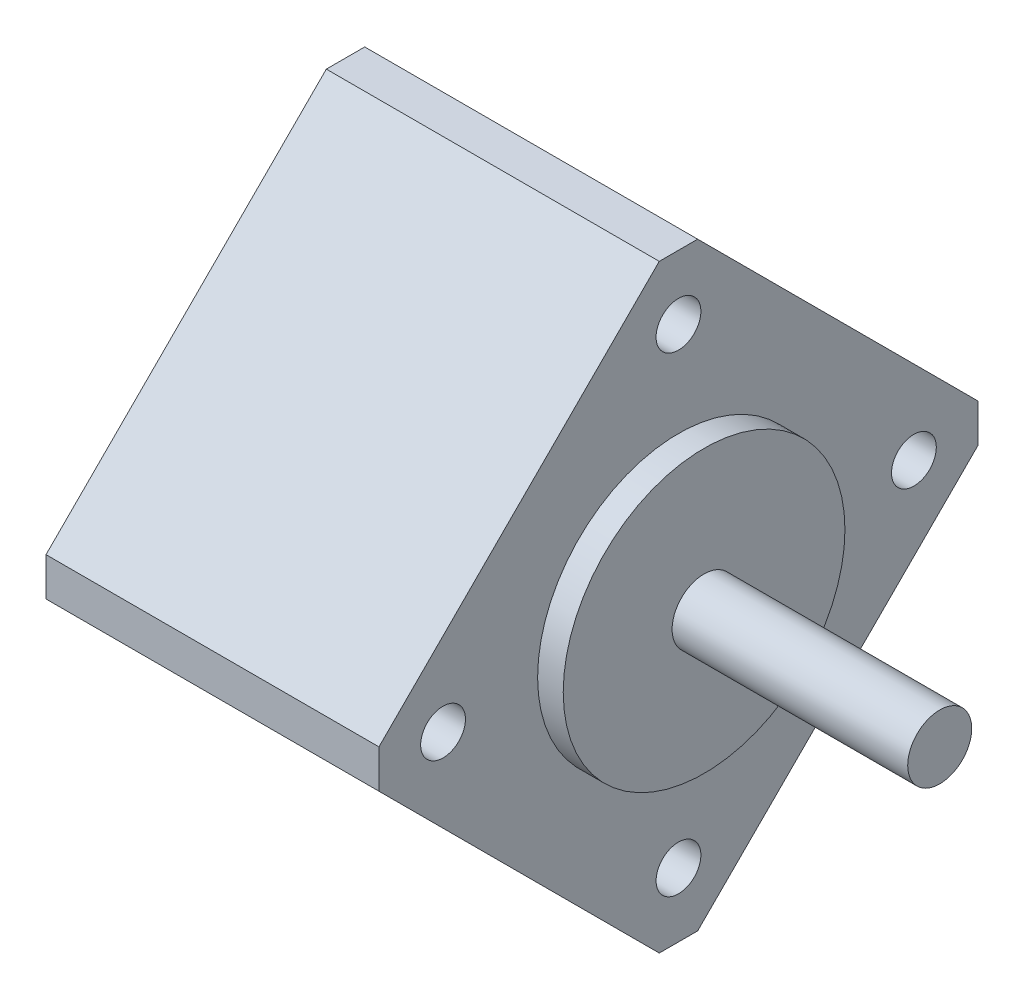
from build123d import *

# Parameters (mm, degrees)
SKETCH3_R           = 1.75
BOSS_EXTRUDE1_DEPTH = 26


with BuildPart() as part:
    # Sketch2 → Revolve1 (revolve)
    with BuildSketch(Plane.XY):
        Polygon((-2.000000064, 0), (18.40000003, 0), (18.40000003, 2.499999953), (0, 2.499999953), (0, 10.999999971), (-2.000000064, 10.999999971), align=None)
    revolve(axis=Axis((0, 0, 0), (1, 0, 0)))

    # Sketch3 → Boss-Extrude1 (add)
    with BuildSketch(Plane.ZY.offset(2.000000064)):
        Polygon((0, 23.390158698), (1.5, 23.390158698), (23.390158698, 1.5), (23.390158698, 0), (23.390158698, -1.5), (1.5, -23.390158698), (0, -23.390158698), (-1.5, -23.390158698), (-23.390158698, -1.5), (-23.390158698, 0), (-23.390158698, 1.5), (-1.5, 23.390158698), align=None)
        with Locations((0, 18.384776311)):
            Circle(SKETCH3_R, mode=Mode.SUBTRACT)
        with Locations((18.384776311, 0)):
            Circle(SKETCH3_R, mode=Mode.SUBTRACT)
        with Locations((0, -18.384776311)):
            Circle(SKETCH3_R, mode=Mode.SUBTRACT)
        with Locations((-18.384776311, 0)):
            Circle(SKETCH3_R, mode=Mode.SUBTRACT)
    extrude(amount=BOSS_EXTRUDE1_DEPTH)


solid = part.part
